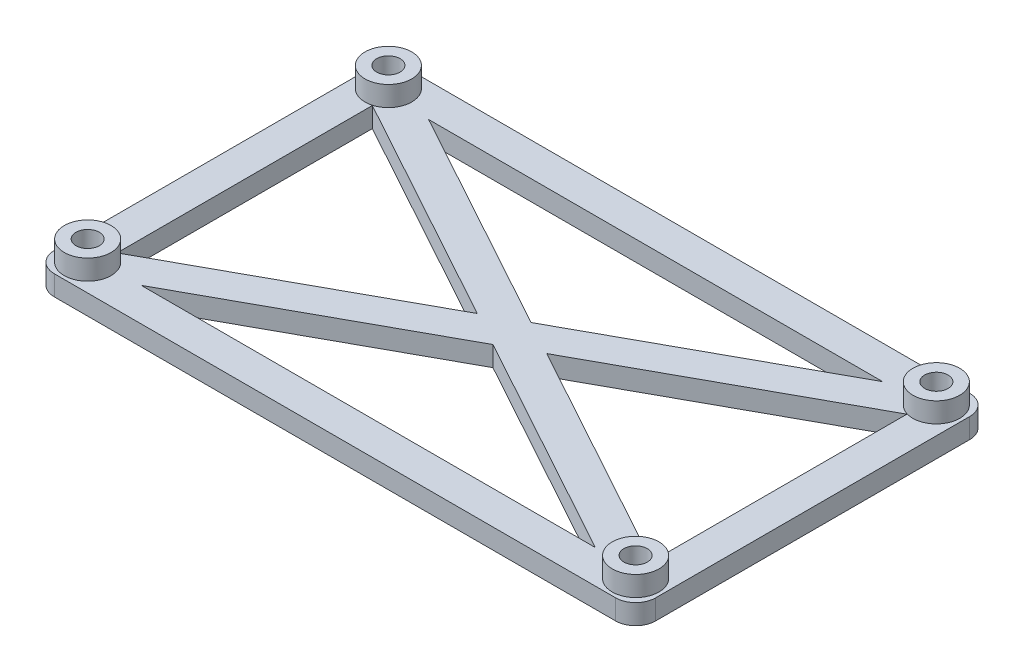
from build123d import *

# Parameters (mm, degrees)
CROQUIS1_W              = 90
CROQUIS1_H              = 53
SALIENTE_EXTRUIR1_DEPTH = 3
CROQUIS2_R              = 1.75
CORTAR_EXTRUIR1_DEPTH   = 53.309177015
CROQUIS3_R              = 3.5
CROQUIS3_R_2            = 1.75
SALIENTE_EXTRUIR2_DEPTH = 3
REDONDEO1_R             = 3
CORTAR_EXTRUIR2_DEPTH   = 53.566624392


with BuildPart() as part:
    # Croquis1 → Saliente-Extruir1 (new body)
    with BuildSketch(Plane(origin=(0, 0, 0), x_dir=(1, 0, 0), z_dir=(0, 1, 0))):
        Rectangle(CROQUIS1_W, CROQUIS1_H)
    extrude(amount=SALIENTE_EXTRUIR1_DEPTH)

    # Croquis2 → Cortar-Extruir1 (cut, through all)
    with BuildSketch(Plane.XZ):
        with Locations((41, -22.5)):
            Circle(CROQUIS2_R)
        with Locations((41, 22.5)):
            Circle(CROQUIS2_R)
        with Locations((-41, 22.5)):
            Circle(CROQUIS2_R)
        with Locations((-41, -22.5)):
            Circle(CROQUIS2_R)
    extrude(amount=-CORTAR_EXTRUIR1_DEPTH, mode=Mode.SUBTRACT)

    # Croquis3 → Saliente-Extruir2 (add)
    # profile 1 of 2: a face of its own
    with BuildSketch(Plane(origin=(0, 3, 0), x_dir=(1, 0, 0), z_dir=(0, 1, 0))):
        with Locations((41, 22.5)):
            Circle(CROQUIS3_R)
        with Locations((41, 22.5)):
            Circle(CROQUIS3_R_2, mode=Mode.SUBTRACT)
    # profile 2 of 2: a face of its own
    with BuildSketch(Plane(origin=(0, 3, 0), x_dir=(1, 0, 0), z_dir=(0, 1, 0))):
        with Locations((-41, 22.5)):
            Circle(CROQUIS3_R)
        with Locations((-41, 22.5)):
            Circle(CROQUIS3_R_2, mode=Mode.SUBTRACT)
    saliente_extruir2 = extrude(amount=SALIENTE_EXTRUIR2_DEPTH)

    # Simetría1: Saliente-Extruir2 across plane
    add(saliente_extruir2.mirror(Plane.XY))

    # Redondeo1
    redondeo1_edges = [part.edges().sort_by_distance(p)[0] for p in [
        (45, 1.5, -26.5),
        (-45, 1.5, -26.5),
        (-45, 1.5, 26.5),
        (45, 1.5, 26.5),
    ]]
    fillet(redondeo1_edges, radius=REDONDEO1_R)

    # Croquis4 → Cortar-Extruir2 (cut, through all)
    with BuildSketch(Plane.XZ):
        Polygon((33.981328373, 21.5), (0, 2.851710039), (-33.981328373, 21.5), align=None)
        Polygon((-40, 19.099509473), (-5.196449405, 0), (-40, -19.099509473), align=None)
        Polygon((40, 19.099509473), (5.196449405, 0), (40, -19.099509473), align=None)
        Polygon((33.981328373, -21.5), (-33.981328373, -21.5), (0, -2.851710039), align=None)
    extrude(amount=-CORTAR_EXTRUIR2_DEPTH, mode=Mode.SUBTRACT)


solid = part.part
